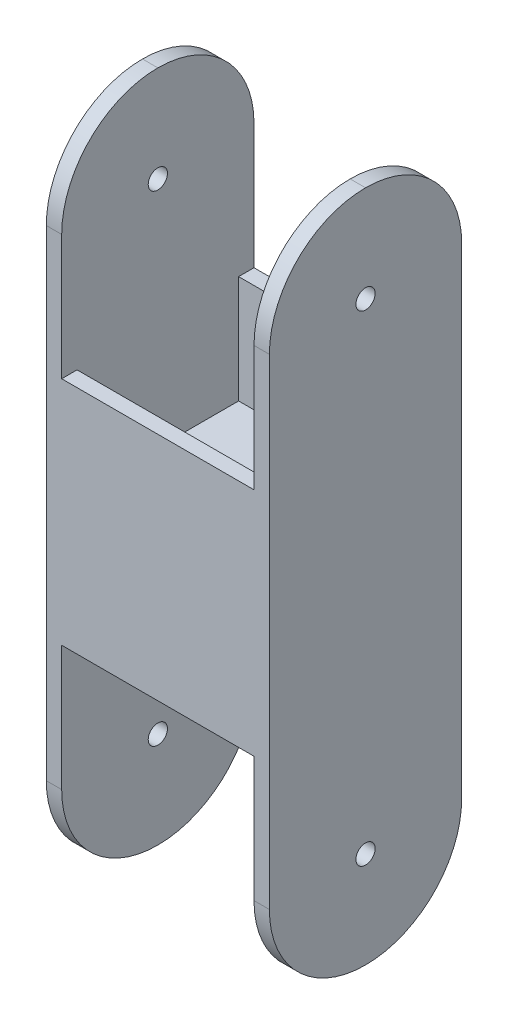
from build123d import *

# Parameters (mm, degrees)
BOSS_EXTRUDE1_DEPTH = 100
FILLET1_R           = 50
SKETCH2_R           = 5
CUT_EXTRUDE1_DEPTH  = 116
SKETCH5_W           = 116
SKETCH5_H           = 120
BOSS_EXTRUDE4_DEPTH = 8
SKETCH6_W           = 100
SKETCH6_H           = 120
BOSS_EXTRUDE6_DEPTH = 8


with BuildPart() as part:
    # Sketch1 → Boss-Extrude1 (new body)
    with BuildSketch(Plane.XY):
        Polygon((8, -171), (8, -8), (8, 0), (0, 0), (0, -8), (0, -146), (0, -154), (0, -292), (0, -350), (8, -350), (8, -292), (8, -179), (108, -179), (108, -292), (108, -350), (116, -350), (116, -292), (116, -154), (116, -146), (116, -8), (116, 0), (108, 0), (108, -8), (108, -171), align=None)
    extrude(amount=BOSS_EXTRUDE1_DEPTH)

    # Fillet1
    fillet1_edges = [part.edges().sort_by_distance(p)[0] for p in [
        (4, 0, 100),
        (4, 0, 0),
        (112, -350, 0),
        (112, -350, 100),
        (4, -350, 100),
        (4, -350, 0),
        (112, 0, 100),
        (112, 0, 0),
    ]]
    fillet(fillet1_edges, radius=FILLET1_R - 0.0001)  # a hair under: the kernel refuses the full size

    # Sketch2 → Cut-Extrude1 (cut)
    with BuildSketch(Plane(origin=(116, 0, 0), x_dir=(0, 0, -1), z_dir=(1, 0, 0))):
        with Locations(Location((-50, -300, 0), (0, 0, 90))):
            Circle(SKETCH2_R)
        with Locations(Location((-50, -50, 0), (0, 0, 90))):
            Circle(SKETCH2_R)
    extrude(amount=-CUT_EXTRUDE1_DEPTH, mode=Mode.SUBTRACT)

    # Sketch5 → Boss-Extrude4 (add)
    with BuildSketch(Plane.XY.offset(100)):
        with Locations((58, -175)):
            Rectangle(SKETCH5_W, SKETCH5_H)
    extrude(amount=-BOSS_EXTRUDE4_DEPTH)

    # Sketch6 → Boss-Extrude6 (add)
    with BuildSketch(Plane(origin=(0, 0, 0), x_dir=(-1, 0, 0), z_dir=(0, 0, -1))):
        with Locations((-58, -175)):
            Rectangle(SKETCH6_W, SKETCH6_H)
    extrude(amount=-BOSS_EXTRUDE6_DEPTH)


solid = part.part
